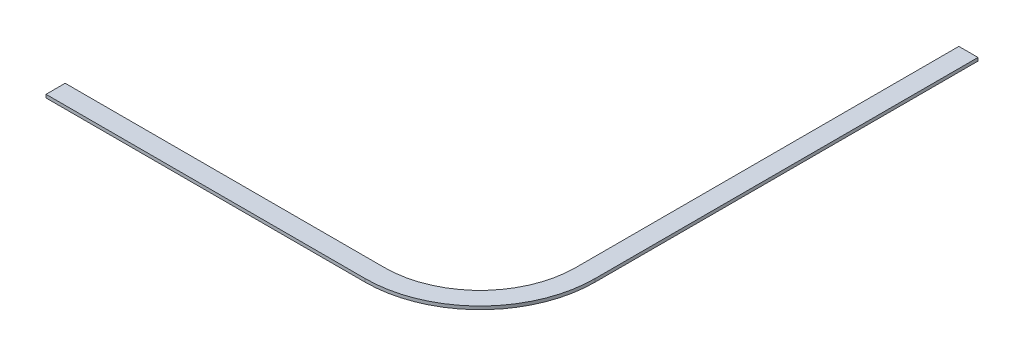
from build123d import *

# Parameters (mm, degrees)
BOSS_EXTRUDE1_DEPTH = 5


with BuildPart() as part:
    # Sketch1 → Boss-Extrude1 (new body)
    with BuildSketch(Plane(origin=(0, 0, 0), x_dir=(1, 0, 0), z_dir=(0, 1, 0))):
        with BuildLine():
            Line((0, 400), (0, -200))
            ThreePointArc((0, -200), (-43.933982822, -306.066017178), (-150, -350))
            Line((-150, -350), (-650, -350))
            Line((-650, -350), (-650, -380))
            Line((-650, -380), (-150, -380))
            ThreePointArc((-150, -380), (-22.720779386, -327.279220614), (30, -200))
            Line((30, -200), (30, 400))
            Line((30, 400), (0, 400))
        make_face()
    extrude(amount=BOSS_EXTRUDE1_DEPTH)


solid = part.part
